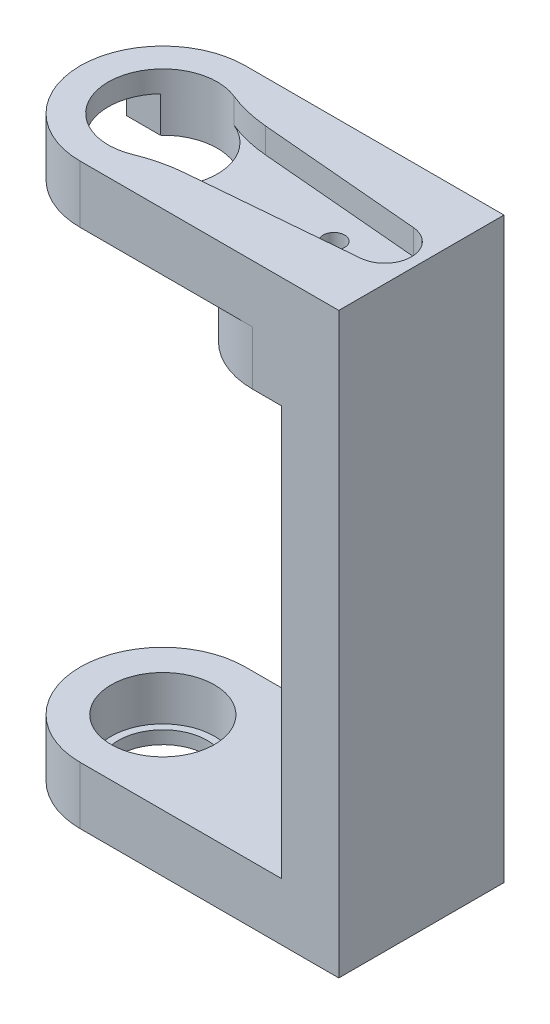
from build123d import *

# Parameters (mm, degrees)
SKETCH1_R                = 5.75
SKETCH1_R_2              = 3.8
BOSS_EXTRUDE1_DEPTH      = 2.25
BOSS_EXTRUDE2_DEPTH      = 2.25
SKETCH3_W                = 11.75
SKETCH3_H                = 11.5
BOSS_EXTRUDE3_DEPTH      = 5.75
BOSS_EXTRUDE4_START      = 1.75
BOSS_EXTRUDE4_DEPTH      = 1.75
FILLET3_R                = 10
SKETCH6_W                = 5.2
SKETCH6_H                = 2.5
CUT_EXTRUDE1_DEPTH       = 21.519807504
SKETCH7_R                = 0.75
CUT_EXTRUDE2_DEPTH       = 21.519807504
FILLET1_RADIUS           = 5.75
FILLET1_LENGTH           = 5.75
BOSS_EXTRUDE5_DEPTH      = 26.5
BOSS_EXTRUDE5_DEPTH_BACK = 4
SKETCH5_W                = 4
SKETCH5_H                = 11.5
CHAMFER1_SIZE            = 2
SKETCH8_R                = 3.6
BOSS_EXTRUDE6_DEPTH      = 4
BOSS_EXTRUDE7_START      = -0.9
SKETCH9_R                = 3.6
SKETCH9_R_2              = 3.1
BOSS_EXTRUDE7_DEPTH      = 0.9


with BuildPart() as part:
    # Sketch1 → Boss-Extrude1 (new body)
    with BuildSketch(Plane(origin=(0, 0, 0), x_dir=(1, 0, 0), z_dir=(0, 1, 0))):
        with Locations(Location((0, 0, 0), (0, 0, 270))):
            Circle(SKETCH1_R)
        with Locations(Location((0, 0, 0), (0, 0, 270))):
            Circle(SKETCH1_R_2, mode=Mode.SUBTRACT)
    extrude(amount=-BOSS_EXTRUDE1_DEPTH)

    # Sketch2 → Boss-Extrude2 (add)
    with BuildSketch(Plane(origin=(0, 0, 0), x_dir=(1, 0, 0), z_dir=(0, 1, 0))):
        with BuildLine():
            Line((0, 5.75), (18, 5.75))
            Line((18, 5.75), (18, -5.75))
            Line((18, -5.75), (0, -5.75))
            ThreePointArc((0, -5.75), (5.75, 0), (0, 5.75))
        make_face()
    extrude(amount=-BOSS_EXTRUDE2_DEPTH)

    # Sketch3 → Boss-Extrude3 (add)
    with BuildSketch(Plane.XZ.offset(2.25)):
        with Locations((12.125, 0)):
            Rectangle(SKETCH3_W, SKETCH3_H)
    extrude(amount=BOSS_EXTRUDE3_DEPTH)

    # Sketch4 → Boss-Extrude4 (add)
    with BuildSketch(Plane(origin=(0, 0, 0), x_dir=(1, 0, 0), z_dir=(0, 1, 0)).offset(BOSS_EXTRUDE4_START)):
        with BuildLine():
            Line((0, -5.75), (18, -5.75))
            Line((18, -5.75), (18, 5.75))
            Line((18, 5.75), (0, 5.75))
            ThreePointArc((0, 5.75), (-5.75, 0), (0, -5.75))
        make_face()
        with BuildLine():
            Line((2.336179457, -2.9970428), (15.610227504, -1.84304833))
            ThreePointArc((15.610227504, -1.84304833), (17.3, 0), (15.610227504, 1.84304833))
            Line((15.610227504, 1.84304833), (2.336179457, 2.9970428))
            ThreePointArc((2.336179457, 2.9970428), (-3.8, 0), (2.336179457, -2.9970428))
        make_face(mode=Mode.SUBTRACT)
    extrude(amount=-BOSS_EXTRUDE4_DEPTH)

    # Fillet3
    # the kernel refuses this fillet: 10 mm, written as the material it takes off along each edge
    with BuildSketch(Plane(origin=(2.336179457, 6.739658122, 2.9970428), x_dir=(-0.8658918638658896, 0, 0.5002312266251037), z_dir=(0, -1, 0))) as fillet3_piece_1:
        with BuildLine():
            CenterArc((2.425392956, -9.90459182), FILLET3_R, 97.920932923, 17.12578451)
            Line((-1.808178045, -0.844962877), (0, 0))
            ThreePointArc((0, 0), (0.523664388, -0.036255108), (1.047328776, 0))
        make_face()
    extrude(amount=6.739658122, mode=Mode.SUBTRACT)
    with BuildSketch(Plane(origin=(2.336179457, 6.739658122, -2.9970428), x_dir=(-0.8658918638659203, 0, -0.5002312266250502), z_dir=(0, -1, 0))) as fillet3_piece_2:
        with BuildLine():
            CenterArc((2.425392956, 9.90459182), FILLET3_R, 244.953282566, 17.12578451)
            Line((-1.808178045, 0.844962877), (0, 0))
            ThreePointArc((0, 0), (0.523664388, 0.036255108), (1.047328776, 0))
        make_face()
    extrude(amount=6.739658122, mode=Mode.SUBTRACT)

    # Sketch6 → Cut-Extrude1 (cut, through all)
    with BuildSketch(Plane(origin=(0, 0, 0), x_dir=(0, 0, -1), z_dir=(1, 0, 0))):
        with Locations((0, -1)):
            Rectangle(SKETCH6_W, SKETCH6_H)
    extrude(amount=-CUT_EXTRUDE1_DEPTH, mode=Mode.SUBTRACT)

    # Sketch7 → Cut-Extrude2 (cut, through all)
    with BuildSketch(Plane(origin=(0, 0, 0), x_dir=(1, 0, 0), z_dir=(0, 1, 0))):
        with Locations(Location((11.91, 0, 0), (0, 0, 270))):
            Circle(SKETCH7_R)
    extrude(amount=-CUT_EXTRUDE2_DEPTH, mode=Mode.SUBTRACT)

    # Fillet1: full round fillet: the end face becomes a half cylinder, R = half its width
    fillet1_face = Plane((6.25, -5.125, 0), x_dir=(0, -1, 0), z_dir=(-1, 0, 0))  # on the end face: x along it, z out of the body
    fillet1_slab = fillet1_face.offset(-FILLET1_RADIUS / 2) * Box(FILLET1_LENGTH, 2 * FILLET1_RADIUS, FILLET1_RADIUS, mode=Mode.PRIVATE)  # the body's end, R deep
    fillet1_round = Plane((12, -5.125, 0), x_dir=(-1, 0, 0), z_dir=(0, -1, 0)) * Cylinder(FILLET1_RADIUS, FILLET1_LENGTH, mode=Mode.PRIVATE)  # its axis R under the face
    add(fillet1_slab - fillet1_round, mode=Mode.SUBTRACT)

    # Sketch5 → Boss-Extrude5 (add, two sides: drawn at the far end of the back side and taken through both)
    with BuildSketch(Plane.XZ.offset(8).offset(-BOSS_EXTRUDE5_DEPTH_BACK)):
        with Locations((16, 0)):
            Rectangle(SKETCH5_W, SKETCH5_H)
    extrude(amount=BOSS_EXTRUDE5_DEPTH + BOSS_EXTRUDE5_DEPTH_BACK)

    # Chamfer1
    chamfer1_edges = [part.edges().sort_by_distance(p)[0] for p in [
        (6.25, -8, 0),
        (13, -8, 5.75),
        (13, -8, -5.75),
    ]]
    chamfer(chamfer1_edges, length=CHAMFER1_SIZE)

    # Sketch8 → Boss-Extrude6 (add)
    with BuildSketch(Plane.XZ.offset(34.5)):
        with BuildLine():
            Line((18, 5.75), (0, 5.75))
            ThreePointArc((0, 5.75), (-5.75, 0), (0, -5.75))
            Line((0, -5.75), (18, -5.75))
            Line((18, -5.75), (18, 5.75))
        make_face()
        with Locations(Location((0, 0, 0), (0, 0, 270))):
            Circle(SKETCH8_R, mode=Mode.SUBTRACT)
    extrude(amount=BOSS_EXTRUDE6_DEPTH)

    # Sketch9 → Boss-Extrude7 (add)
    with BuildSketch(Plane.XZ.offset(38.5).offset(BOSS_EXTRUDE7_START)):
        with Locations(Location((0, 0, 0), (0, 0, 270))):
            Circle(SKETCH9_R)
        with Locations(Location((0, 0, 0), (0, 0, 270))):
            Circle(SKETCH9_R_2, mode=Mode.SUBTRACT)
    extrude(amount=BOSS_EXTRUDE7_DEPTH)


solid = part.part
